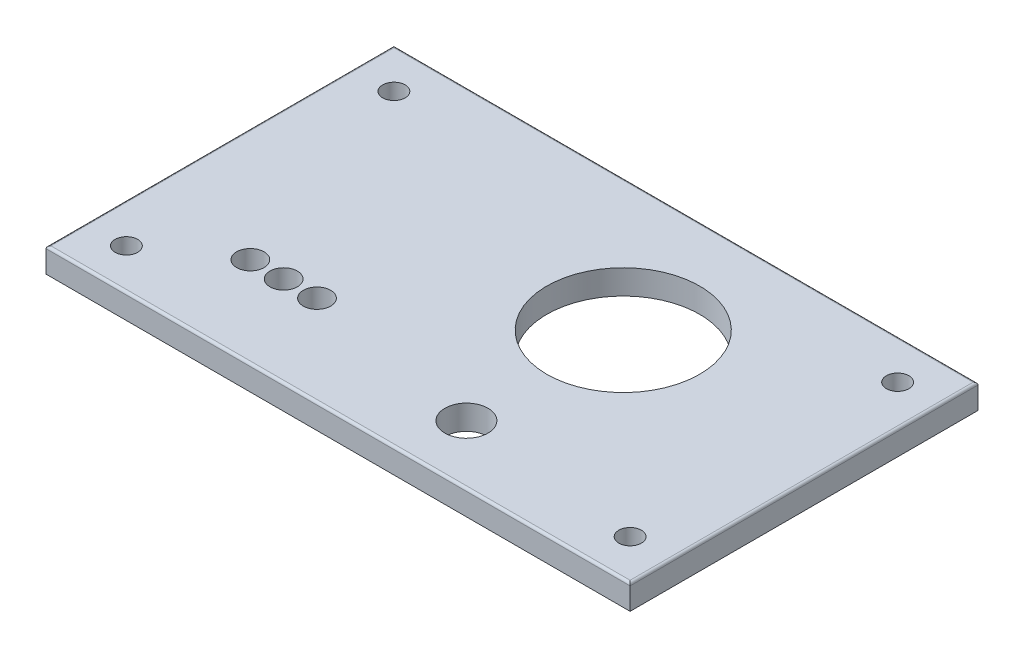
from build123d import *

# Parameters (mm, degrees)
SKETCH1_W           = 59.6
SKETCH1_H           = 35.5
SKETCH1_R           = 1.4
SKETCH1_R_2         = 2.2
SKETCH1_R_3         = 7.8
BOSS_EXTRUDE3_DEPTH = 2.5
SKETCH6_R           = 1.15
CUT_EXTRUDE4_DEPTH  = 5
FILLET4_R           = 0.25


with BuildPart() as part:
    # Sketch1 → Boss-Extrude3 (new body)
    with BuildSketch(Plane(origin=(0, 0, 0), x_dir=(1, 0, 0), z_dir=(0, 1, 0))):
        Rectangle(SKETCH1_W, SKETCH1_H)
        with Locations((-18.15, -8.55)):
            Circle(SKETCH1_R, mode=Mode.SUBTRACT)
        with Locations((-14.75, -8.55)):
            Circle(SKETCH1_R, mode=Mode.SUBTRACT)
        with Locations((-11.35, -8.55)):
            Circle(SKETCH1_R, mode=Mode.SUBTRACT)
        with Locations((7.1, -11.75)):
            Circle(SKETCH1_R_2, mode=Mode.SUBTRACT)
        with Locations((7.1, 4.25)):
            Circle(SKETCH1_R_3, mode=Mode.SUBTRACT)
    extrude(amount=BOSS_EXTRUDE3_DEPTH)

    # Sketch6 → Cut-Extrude4 (cut)
    with BuildSketch(Plane(origin=(0, 2.5, 0), x_dir=(1, 0, 0), z_dir=(0, 1, 0))):
        with Locations((-25.7, 13.65)):
            Circle(SKETCH6_R)
        with Locations((25.7, 13.65)):
            Circle(SKETCH6_R)
        with Locations((25.7, -13.65)):
            Circle(SKETCH6_R)
        with Locations((-25.7, -13.65)):
            Circle(SKETCH6_R)
    extrude(amount=-CUT_EXTRUDE4_DEPTH, mode=Mode.SUBTRACT)

    # Fillet4
    fillet4_edges = [part.edges().sort_by_distance(p)[0] for p in [
        (29.8, 2.5, 0),
        (-29.8, 2.5, 0),
        (0, 2.5, 17.75),
        (0, 2.5, -17.75),
    ]]
    fillet(fillet4_edges, radius=FILLET4_R)


solid = part.part
